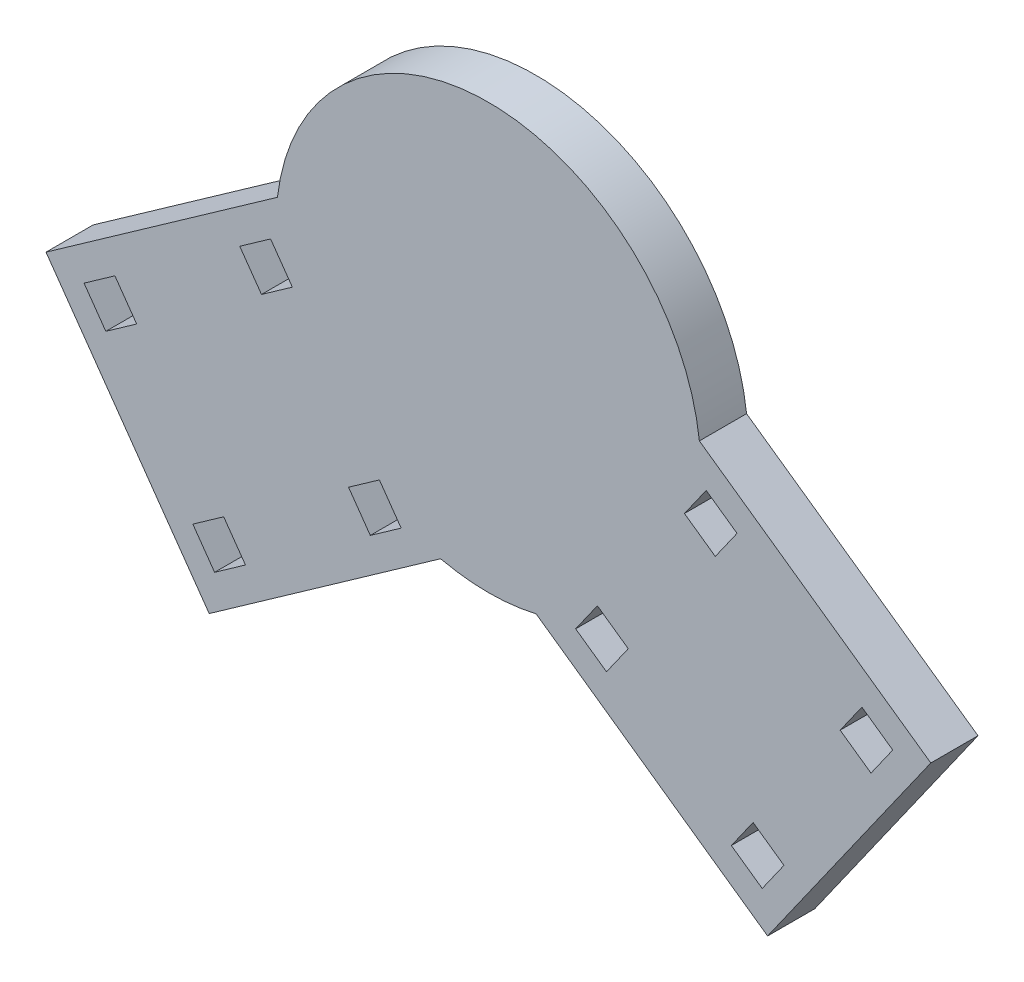
from build123d import *

# Parameters (mm, degrees)
SKETCH2_R           = 22.5
BOSS_EXTRUDE1_DEPTH = 5
CUT_EXTRUDE1_DEPTH  = 10


with BuildPart() as part:
    # Sketch2 → Boss-Extrude1 (new body)
    with BuildSketch(Plane.XY):
        Circle(SKETCH2_R)
        Polygon((5.061398723, -21.923326458), (22.349954637, 2.594133329), (46.867414424, -14.694422585), (29.57885851, -39.211882372), align=None)
        Polygon((-5.061398723, -21.923326458), (-22.349954637, 2.594133329), (-46.867414424, -14.694422585), (-29.57885851, -39.211882372), align=None)
    extrude(amount=BOSS_EXTRUDE1_DEPTH)

    # Sketch4 → Cut-Extrude1 (cut)
    with BuildSketch(Plane.XY.offset(5)):
        Polygon((-42.837051435, -15.523254131), (-39.568056796, -13.218113343), (-37.262916008, -16.487107981), (-40.531910646, -18.792248769), align=None)
        Polygon((-31.311347492, -31.868227322), (-28.042352854, -29.563086534), (-25.737212065, -32.832081172), (-29.006206703, -35.137221961), align=None)
        Polygon((-11.547141081, -17.931441432), (-14.81613572, -20.236582221), (-12.510994931, -23.505576859), (-9.242000293, -21.20043607), align=None)
        Polygon((-26.341839662, -3.891609029), (-23.072845024, -1.586468241), (-20.767704236, -4.855462879), (-24.036698874, -7.160603668), align=None)
        Polygon((23.072845024, -1.586468241), (26.341839662, -3.891609029), (24.036698874, -7.160603668), (20.767704236, -4.855462879), align=None)
        Polygon((37.262916008, -16.487107981), (39.568056796, -13.218113343), (42.837051435, -15.523254131), (40.531910646, -18.792248769), align=None)
        Polygon((28.042352854, -29.563086534), (31.311347492, -31.868227322), (29.006206703, -35.137221961), (25.737212065, -32.832081172), align=None)
        Polygon((11.547141081, -17.931441432), (14.81613572, -20.236582221), (12.510994931, -23.505576859), (9.242000293, -21.20043607), align=None)
    extrude(amount=-CUT_EXTRUDE1_DEPTH, mode=Mode.SUBTRACT)


solid = part.part
